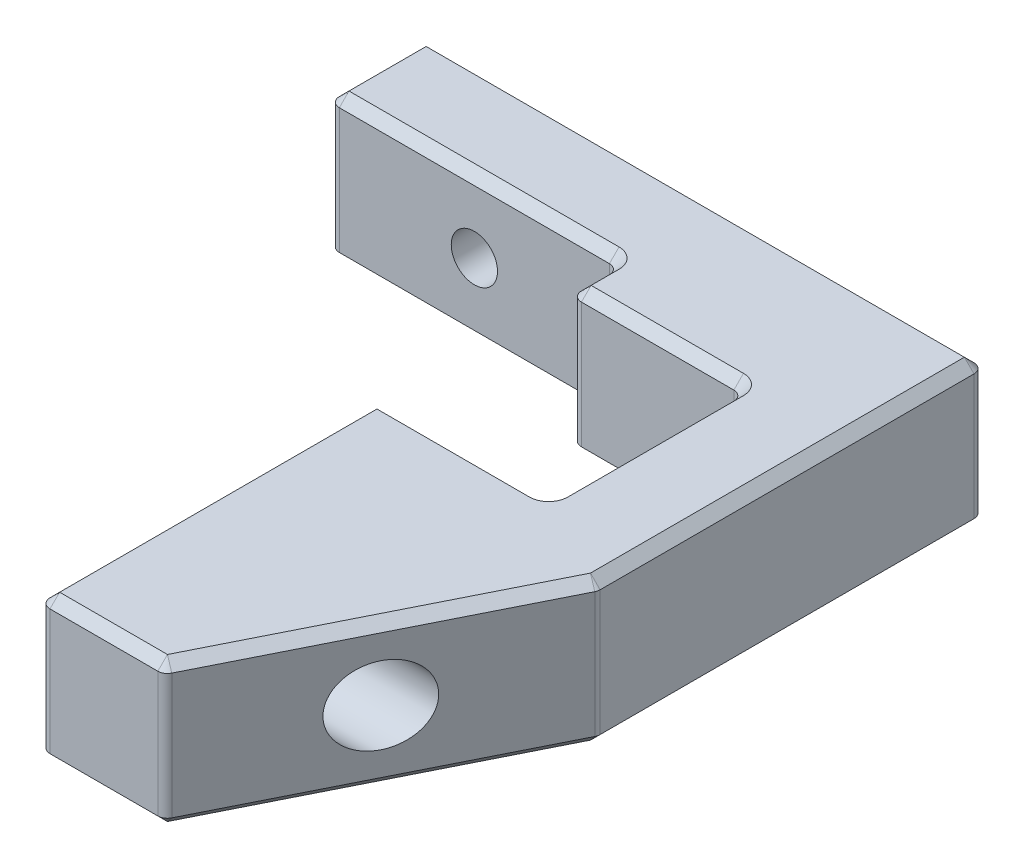
from build123d import *

# Parameters (mm, degrees)
BOSS_EXTRUDE1_DEPTH                                 = 7.5
CBORE_FOR_M4_HEX_SOCKET_HEAD_CAP_SCREW2_D           = 4.8
CBORE_FOR_M4_HEX_SOCKET_HEAD_CAP_SCREW2_CBORE_D     = 8
CBORE_FOR_M4_HEX_SOCKET_HEAD_CAP_SCREW2_CBORE_DEPTH = 4.4
CHAMFER1_SIZE                                       = 30
CHAMFER1_SIZE_2                                     = 15
FILLET1_R                                           = 1
CHAMFER2_SIZE                                       = 1


# Some blends are built 0.0001 mm under size
with BuildPart() as part:
    # Sketch2 → Boss-Extrude1 (new, symmetric)
    with BuildSketch(Plane(origin=(0, 0, 0), x_dir=(1, 0, 0), z_dir=(0, 1, 0))):
        Polygon((0, 0), (0, 70), (-57.8, 70), (-57.8, 60), (-27.8, 60), (-27.8, 55.1), (-10, 55.1), (-10, 34.9), (-27.8, 34.9), (-27.8, 0), align=None)
    extrude(amount=BOSS_EXTRUDE1_DEPTH, both=True)

    # Sketch4 → CBORE for M4 Hex Socket Head Cap Screw1 (revolve, cut)
    with BuildSketch(Plane(origin=(0, 0, -15), x_dir=(0, 0, -1), z_dir=(0, 1, 0))):
        Polygon((0, 0), (0, 27.8), (2.4, 27.8), (2.4, 22), (4, 22), (4, 0.025), (4.025, 0), align=None)
    revolve(axis=Axis((6.35, 0, -15), (-1, 0, 0)), mode=Mode.SUBTRACT)

    # CBORE for M4 Hex Socket Head Cap Screw2 (through all)
    with Locations(Plane(origin=(0, 0, -70), x_dir=(-1, 0, 0), z_dir=(0, 0, -1))):
        with Locations((42.8, 0)):
            CounterBoreHole(CBORE_FOR_M4_HEX_SOCKET_HEAD_CAP_SCREW2_D / 2, CBORE_FOR_M4_HEX_SOCKET_HEAD_CAP_SCREW2_CBORE_D / 2, CBORE_FOR_M4_HEX_SOCKET_HEAD_CAP_SCREW2_CBORE_DEPTH)

    # Chamfer1
    # the kernel refuses this chamfer: 30, 15 mm, written as the material it takes off along each edge
    with BuildSketch(Plane(origin=(0, 85.194866214, 0), x_dir=(0.01726807512366813, 0, -0.9998508956747117), z_dir=(0, -1, 0))) as chamfer1_piece_1:
        Polygon((CHAMFER1_SIZE * 0.999850895675, -CHAMFER1_SIZE * 0.0172680751237), (-CHAMFER1_SIZE_2 * 0.0172680751237, -CHAMFER1_SIZE_2 * 0.999850895675), (0, 0), align=None)
    extrude(amount=170.389732427, mode=Mode.SUBTRACT)

    # Fillet1
    fillet1_edges = [part.edges().sort_by_distance(p)[0] for p in [
        (0, 0, -70),
        (-27.8, 0, 0),
        (-27.8, 0, -34.9),
        (-10, 0, -34.9),
        (-10, 0, -55.1),
        (-27.8, 0, -55.1),
        (-27.8, 0, -60),
        (-57.8, 0, -60),
        (-57.8, 0, -70),
        (0, 0, -30),
        (-15, 0, 0),
    ]]
    fillet(fillet1_edges, radius=FILLET1_R)

    # Chamfer2
    chamfer2_edges = [part.edges().sort_by_distance(p)[0] for p in [
        (-28.092893219, -7.5, -59.707106781),
        (-28.092893219, 7.5, -59.707106781),
        (-10.292893219, -7.5, -35.192893219),
        (-10.292893219, 7.5, -35.192893219),
        (-10.292893219, -7.5, -54.807106781),
        (-10.292893219, 7.5, -54.807106781),
        (-27.8, -7.5, -57.55),
        (-27.8, 7.5, -57.55),
        (-42.8, -7.5, -60),
        (-42.8, 7.5, -60),
        (-18.9, -7.5, -34.9),
        (-18.9, 7.5, -34.9),
        (-10, -7.5, -45),
        (-10, 7.5, -45),
        (-18.9, -7.5, -55.1),
        (-18.9, 7.5, -55.1),
        (-57.8, -7.5, -65),
        (-57.8, 7.5, -65),
        (0, -7.5, -49.618033989),
        (-7.414589803, -7.5, -15.170820393),
        (-21.209016994, -7.5, 0),
        (-27.8, -7.5, -17.45),
        (-28.9, -7.5, -70),
        (-27.507106781, -7.5, -55.392893219),
        (-27.507106781, -7.5, -34.607106781),
        (-57.507106781, -7.5, -60.292893219),
        (-27.507106781, -7.5, -0.292893219),
        (-15.092302877, -7.5, -0.149349192),
        (-0.026751011, -7.5, -30.006315057),
        (-0.292893219, -7.5, -69.707106781),
        (-57.507106781, -7.5, -69.707106781),
        (-28.9, 7.5, -70),
        (-21.209016994, 7.5, 0),
        (-7.414589803, 7.5, -15.170820393),
        (0, 7.5, -49.618033989),
        (-27.8, 7.5, -17.45),
        (-27.507106781, 7.5, -55.392893219),
        (-27.507106781, 7.5, -34.607106781),
        (-57.507106781, 7.5, -60.292893219),
        (-27.507106781, 7.5, -0.292893219),
        (-15.092302877, 7.5, -0.149349192),
        (-0.026751011, 7.5, -30.006315057),
        (-0.292893219, 7.5, -69.707106781),
        (-57.507106781, 7.5, -69.707106781),
    ]]
    chamfer(chamfer2_edges, length=CHAMFER2_SIZE - 0.0001)  # a hair under: the kernel refuses the full size


solid = part.part
